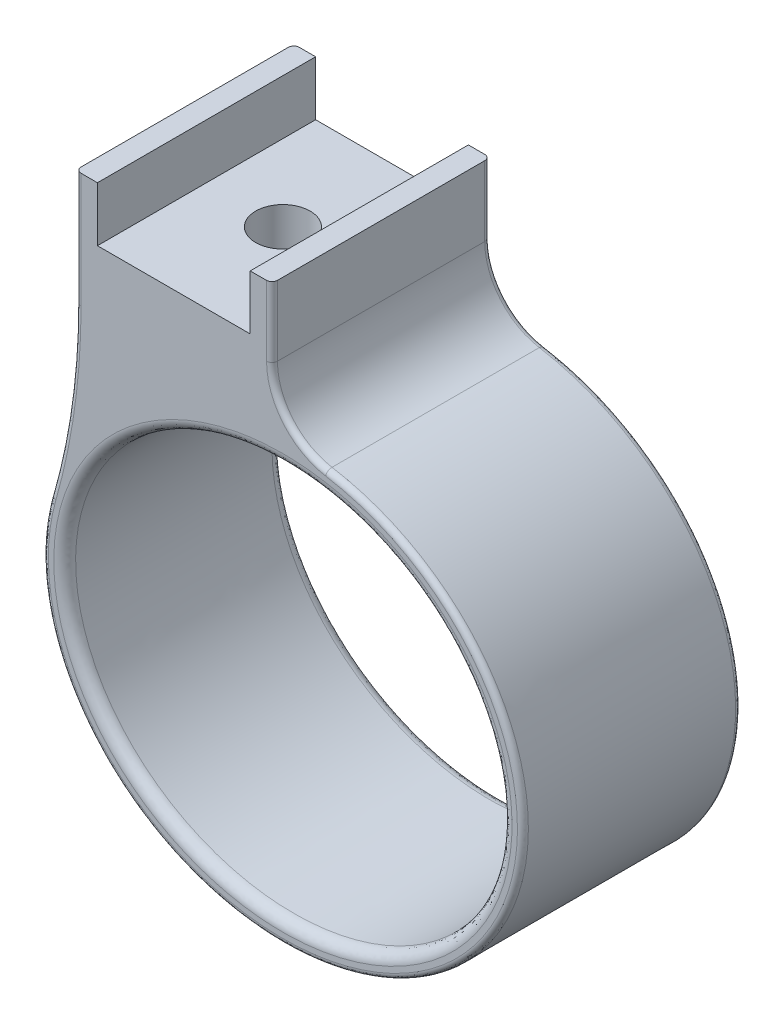
from build123d import *

# Parameters (mm, degrees)
BOSS_EXTRUDE2_DEPTH   = 10
BOSS_EXTRUDE3_DEPTH   = 10
FILLET1_R             = 30
FILLET2_R             = 3
FILLET3_R             = 0.5
FILLET4_R             = 0.25
M3_TAPPED_HOLE1_D     = 2.5
M3_TAPPED_HOLE1_DEPTH = 13.5
M3_TAPPED_HOLE1_TIP   = 0.751075774


# Read off the part's stored shape, not the designer's step: Boss-Extrude2
with BuildPart() as part:
    # Boss-Extrude2 outline → Boss-Extrude2 (new body)
    with BuildSketch(Plane.XY):
        with BuildLine():
            add(Edge.make_bspline(
                [(11, 0), (11, 1.323116596), (10.413287267, 3.969349789), (7.936718091, 7.296007262), (4.280035629, 9.490152223), (0, 10.254923888), (-4.280035629, 9.490152223), (-7.936718091, 7.296007262), (-10.413287267, 3.969349789), (-11.293356366, 0), (-10.413287267, -3.969349789), (-7.936718091, -7.296007262), (-4.280035629, -9.490152223), (0, -10.254923888), (4.280035629, -9.490152223), (7.936718091, -7.296007262), (10.413287267, -3.969349789), (11, -1.323116596), (11, 0)],
                knots=[0, 0, 0, 0, 0.392699082, 0.785398163, 1.178097245, 1.570796327, 1.963495408, 2.35619449, 2.748893572, 3.141592654, 3.534291735, 3.926990817, 4.319689899, 4.71238898, 5.105088062, 5.497787144, 5.890486225, 6.283185307, 6.283185307, 6.283185307, 6.283185307], degree=3))
        make_face()
        with BuildLine():
            add(Edge.make_bspline(
                [(10, 0), (10, 15.588457268), (-5, 7.794228634), (-20, 0), (-5, -7.794228634), (10, -15.588457268), (10, 0)],
                knots=[0, 0, 0, 2.094395102, 2.094395102, 4.188790205, 4.188790205, 6.283185307, 6.283185307, 6.283185307], degree=2, weights=[1, 0.5, 1, 0.5, 1, 0.5, 1]))
        make_face(mode=Mode.SUBTRACT)
    extrude(amount=BOSS_EXTRUDE2_DEPTH)

    # Sketch3 → Boss-Extrude3 (add)
    with BuildSketch(Plane.XY.offset(10)):
        with BuildLine():
            Line((-9.5, 16), (-9.5, 2.810249099))
            add(Edge.make_bspline(
                [(-0.5, 8.98874296), (-7.356406567, 8.679818267), (-9.5, 2.810249099)],
                knots=[1.620817184, 1.620817184, 1.620817184, 2.824032224, 2.824032224, 2.824032224], degree=2, weights=[1, 0.824426875, 1]))
            Line((-0.5, 8.98874296), (-0.5, 16))
            Line((-0.5, 16), (-1.5, 16))
            Line((-1.5, 16), (-1.5, 13.5))
            Line((-1.5, 13.5), (-8.5, 13.5))
            Line((-8.5, 13.5), (-8.5, 16))
            Line((-8.5, 16), (-9.5, 16))
        make_face()
    extrude(amount=-BOSS_EXTRUDE3_DEPTH)

    # Fillet1
    fillet1_edges = [part.edges().sort_by_distance(p)[0] for p in [
        (-9.5, 5.042060233, 5),
    ]]
    fillet(fillet1_edges, radius=FILLET1_R)

    # Fillet2
    fillet2_edges = [part.edges().sort_by_distance(p)[0] for p in [
        (-0.5, 9.989582688, 5),
    ]]
    fillet(fillet2_edges, radius=FILLET2_R)

    # Fillet3
    fillet3_edges = [part.edges().sort_by_distance(p)[0] for p in [
        (-1.430533104, -8.90743486, 0),
        (-5.938096981, 7.241449678, 0),
        (6.690920215, 6.688616091, 0),
        (-1.430533104, -8.90743486, 10),
        (-5.938096981, 7.241449678, 10),
        (6.690920215, 6.688616091, 10),
    ]]
    fillet(fillet3_edges, radius=FILLET3_R)

    # Fillet4
    fillet4_edges = [part.edges().sort_by_distance(p)[0] for p in [
        (-9.5, 13.363630993, 0),
        (-9.5, 13.363630993, 10),
        (-5.938094896, 7.24144707, 0.5),
        (-5.938094896, 7.24144707, 9.5),
        (-9.788089084, 6.579690438, 10),
        (-9.788089084, 6.579690438, 0),
        (-0.5, 14.395487947, 0),
        (-0.5, 14.395487947, 10),
        (0.209482505, 10.853573095, 10),
        (0.209482505, 10.853573095, 0),
    ]]
    fillet(fillet4_edges, radius=FILLET4_R)

    # M3 Tapped Hole1
    with Locations(Plane(origin=(0, 13.5, 0), x_dir=(1, 0, 0), z_dir=(0, 1, 0))):
        with Locations((-5, -5)):
            Hole(M3_TAPPED_HOLE1_D / 2, depth=M3_TAPPED_HOLE1_DEPTH)
            with Locations((0, 0, -(M3_TAPPED_HOLE1_DEPTH + M3_TAPPED_HOLE1_TIP / 2))):  # 118° drill point
                Cone(0, M3_TAPPED_HOLE1_D / 2, M3_TAPPED_HOLE1_TIP, mode=Mode.SUBTRACT)


solid = part.part
